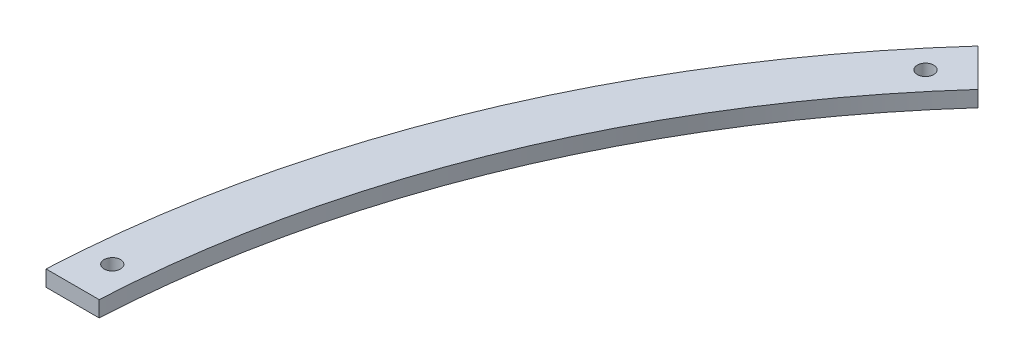
from build123d import *

# Parameters (mm, degrees)
BASE_DEPTH                 = 1.5
F_3_1_3_1_DIAMETER_HOLE1_D = 3.1


with BuildPart() as part:
    # Sketch1 → base (new, symmetric)
    with BuildSketch(Plane(origin=(0, 0, 0), x_dir=(1, 0, 0), z_dir=(0, 1, 0))):
        with BuildLine():
            Line((-141.235146462, 127.093010838), (-148.31553673, 134.173401106))
            ThreePointArc((-148.31553673, 134.173401106), (-184.775906502, 76.536686473), (-199.749843554, 10))
            Line((-199.749843554, 10), (-189.73665961, 10))
            ThreePointArc((-189.73665961, 10), (-175.537111177, 72.709852149), (-141.235146462, 127.093010838))
        make_face()
    extrude(amount=BASE_DEPTH, both=True)

    # Ø3.1 (3.1) Diameter Hole1 (through all)
    with Locations(Plane(origin=(0, 1.5, 0), x_dir=(1, 0, 0), z_dir=(0, 1, 0))):
        with Locations((-194.257966128, 16.995369836), (-149.378666408, 125.343583889)):
            Hole(F_3_1_3_1_DIAMETER_HOLE1_D / 2)


solid = part.part
